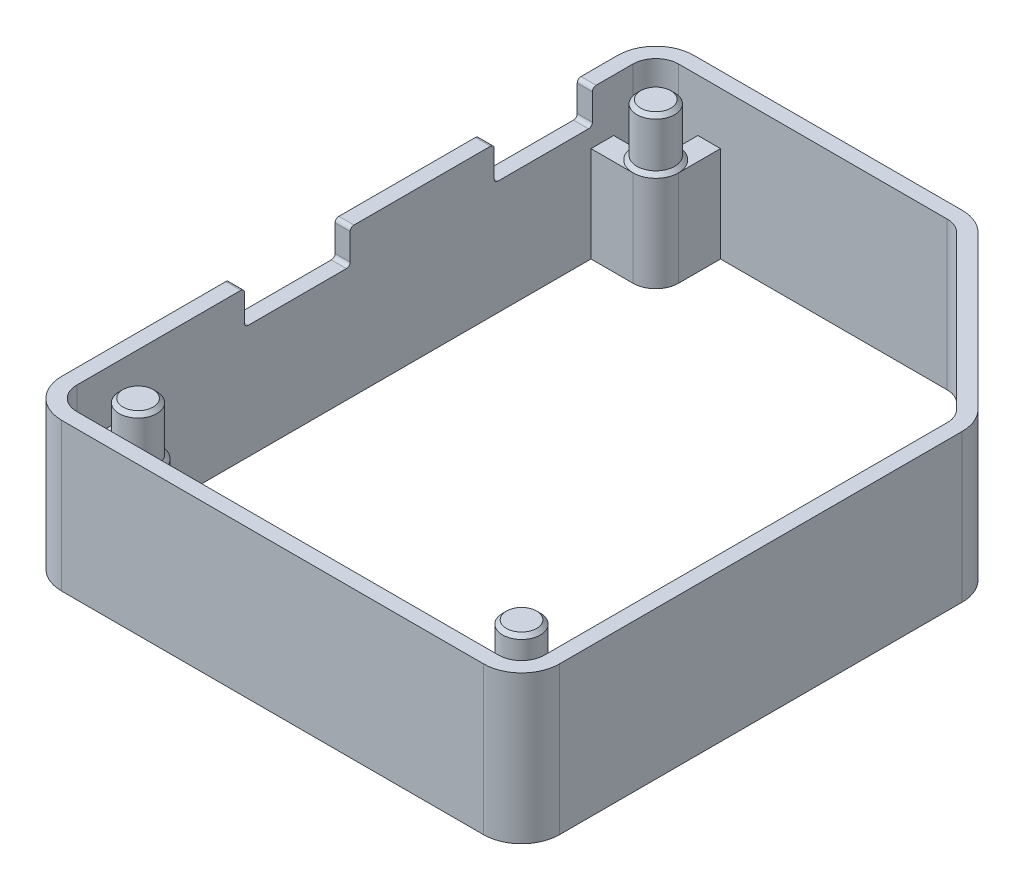
from build123d import *

# Parameters (mm, degrees)
WALLS_DEPTH               = 1.6
WALLS_DEPTH_BACK          = 18
PORTS_REACH               = 81.148
PORT_SKETCH_W             = 14
PORT_SKETCH_H             = 4.5
PORT_SKETCH_W_2           = 13
PORT_FILLET_R             = 0.5
MOUNTING_BASE_START       = -11.07
MOUNTING_BASE_SKETCH_R    = 2.5
MOUNTING_BASE_DEPTH       = 12.67
MOUNTING_PINS_START       = -18
MOUNTING_BASE_SKETCH_2_R  = 2.5
MOUNTING_PINS_DEPTH       = 19.6
MOUNTING_PIN_CHAMFER_SIZE = 0.5


with BuildPart() as part:
    # Base_Sketch → Walls (new, two sides: drawn at the far end of the back side and taken through both)
    with BuildSketch(Plane(origin=(0, -11.07, 0), x_dir=(-1, 0, 0), z_dir=(0, -1, 0)).offset(-WALLS_DEPTH_BACK)):
        with BuildLine():
            Line((-32.98, 16.51), (-32.98, -36.83))
            ThreePointArc((-32.98, -36.83), (-31.503818177, -40.393818177), (-27.94, -41.87))
            Line((-27.94, -41.87), (27.94, -41.87))
            ThreePointArc((27.94, -41.87), (31.503818177, -40.393818177), (32.98, -36.83))
            Line((32.98, -36.83), (32.98, 36.83))
            ThreePointArc((32.98, 36.83), (31.503818177, 40.393818177), (27.94, 41.87))
            Line((27.94, 41.87), (-7.62, 41.87))
            ThreePointArc((-7.62, 41.87), (-9.548724499, 41.486352844), (-11.183818177, 40.393818177))
            Line((-11.183818177, 40.393818177), (-31.503818177, 20.073818177))
            ThreePointArc((-31.503818177, 20.073818177), (-32.596352844, 18.438724499), (-32.98, 16.51))
        make_face()
        with BuildLine():
            Line((-30.98, 16.51), (-30.98, -36.83))
            ThreePointArc((-30.98, -36.83), (-30.089604615, -38.979604615), (-27.94, -39.87))
            Line((-27.94, -39.87), (27.94, -39.87))
            ThreePointArc((27.94, -39.87), (30.089604615, -38.979604615), (30.98, -36.83))
            Line((30.98, -36.83), (30.98, 36.83))
            ThreePointArc((30.98, 36.83), (30.089604615, 38.979604615), (27.94, 39.87))
            Line((27.94, 39.87), (-7.62, 39.87))
            ThreePointArc((-7.62, 39.87), (-8.783357634, 39.638593779), (-9.769604615, 38.979604615))
            Line((-9.769604615, 38.979604615), (-30.089604615, 18.659604615))
            ThreePointArc((-30.089604615, 18.659604615), (-30.748593779, 17.673357634), (-30.98, 16.51))
        make_face(mode=Mode.SUBTRACT)
    extrude(amount=WALLS_DEPTH + WALLS_DEPTH_BACK)

    # Port_Sketch → Ports (cut, up to next)
    with BuildSketch(Plane.ZY.offset(32.98), mode=Mode.PRIVATE) as ports_sk1:
        with Locations((7.61, 4.68)):
            Rectangle(PORT_SKETCH_W, PORT_SKETCH_H)
    ports_tool1 = extrude(ports_sk1.sketch, amount=-PORTS_REACH, mode=Mode.PRIVATE) & part.part
    # Port_Sketch → Ports (cut, up to next)
    with BuildSketch(Plane.ZY.offset(32.98), mode=Mode.PRIVATE) as ports_sk2:
        with Locations((-24.97, 4.68)):
            Rectangle(PORT_SKETCH_W_2, PORT_SKETCH_H)
    ports_tool2 = extrude(ports_sk2.sketch, amount=-PORTS_REACH, mode=Mode.PRIVATE) & part.part
    add(ports_tool1.solids().sort_by_distance((-32.98, 4.68, 7.61))[0], mode=Mode.SUBTRACT)
    add(ports_tool2.solids().sort_by_distance((-32.98, 4.68, -24.97))[0], mode=Mode.SUBTRACT)

    # Port_Fillet
    port_fillet_edges = [part.edges().sort_by_distance(p)[0] for p in [
        (-31.98, 6.93, -18.47),
        (-31.98, 6.93, -31.47),
        (-31.98, 2.43, -31.47),
        (-31.98, 2.43, -18.47),
        (-31.98, 2.43, 0.61),
        (-31.98, 6.93, 0.61),
        (-31.98, 6.93, 14.61),
        (-31.98, 2.43, 14.61),
    ]]
    fillet(port_fillet_edges, radius=PORT_FILLET_R)

    # Mounting_Base_Sketch → Mounting_Base (add)
    # profile 1 of 3: a face of its own
    with BuildSketch(Plane(origin=(0, -11.07, 0), x_dir=(-1, 0, 0), z_dir=(0, -1, 0)).offset(MOUNTING_BASE_START)):
        with BuildLine():
            Line((22.400144884, -34.290144884), (22.400144884, -39.87))
            Line((22.400144884, -39.87), (25.400144884, -39.87))
            Line((25.400144884, -39.87), (25.400144884, -37.290144884))
            ThreePointArc((25.400144884, -37.290144884), (27.521465228, -36.411465228), (28.400144884, -34.290144884))
            Line((28.400144884, -34.290144884), (30.98, -34.290144884))
            Line((30.98, -34.290144884), (30.98, -31.290144884))
            Line((30.98, -31.290144884), (25.400144884, -31.290144884))
            ThreePointArc((25.400144884, -31.290144884), (23.27882454, -32.16882454), (22.400144884, -34.290144884))
        make_face()
        with Locations(Location((25.400144884, -34.290144884, 0), (0, 0, 270))):
            Circle(MOUNTING_BASE_SKETCH_R, mode=Mode.SUBTRACT)
    # profile 2 of 3: a face of its own
    with BuildSketch(Plane(origin=(0, -11.07, 0), x_dir=(-1, 0, 0), z_dir=(0, -1, 0)).offset(MOUNTING_BASE_START)):
        with BuildLine():
            Line((-25.400144884, -31.290144884), (-30.98, -31.290144884))
            Line((-30.98, -31.290144884), (-30.98, -34.290144884))
            Line((-30.98, -34.290144884), (-28.400144884, -34.290144884))
            ThreePointArc((-28.400144884, -34.290144884), (-27.521465228, -36.411465228), (-25.400144884, -37.290144884))
            Line((-25.400144884, -37.290144884), (-25.400144884, -39.87))
            Line((-25.400144884, -39.87), (-22.400144884, -39.87))
            Line((-22.400144884, -39.87), (-22.400144884, -34.290144884))
            ThreePointArc((-22.400144884, -34.290144884), (-23.27882454, -32.16882454), (-25.400144884, -31.290144884))
        make_face()
        with Locations(Location((-25.400144884, -34.290144884, 0), (0, 0, 270))):
            Circle(MOUNTING_BASE_SKETCH_R, mode=Mode.SUBTRACT)
    # profile 3 of 3: a face of its own
    with BuildSketch(Plane(origin=(0, -11.07, 0), x_dir=(-1, 0, 0), z_dir=(0, -1, 0)).offset(MOUNTING_BASE_START)):
        with BuildLine():
            Line((22.400144884, 34.290144884), (22.400144884, 39.87))
            Line((22.400144884, 39.87), (25.400144884, 39.87))
            Line((25.400144884, 39.87), (25.400144884, 37.290144884))
            ThreePointArc((25.400144884, 37.290144884), (27.521465228, 36.411465228), (28.400144884, 34.290144884))
            Line((28.400144884, 34.290144884), (30.98, 34.290144884))
            Line((30.98, 34.290144884), (30.98, 31.290144884))
            Line((30.98, 31.290144884), (25.400144884, 31.290144884))
            ThreePointArc((25.400144884, 31.290144884), (23.27882454, 32.16882454), (22.400144884, 34.290144884))
        make_face()
        with Locations(Location((25.400144884, 34.290144884, 0), (0, 0, 270))):
            Circle(MOUNTING_BASE_SKETCH_R, mode=Mode.SUBTRACT)
    extrude(amount=MOUNTING_BASE_DEPTH)

    # Mounting_Base_Sketch<2> → Mounting_Pins (add)
    with BuildSketch(Plane(origin=(0, -11.07, 0), x_dir=(-1, 0, 0), z_dir=(0, -1, 0)).offset(MOUNTING_PINS_START)):
        with Locations(Location((-25.400144884, -34.290144884, 0), (0, 0, 90))):
            Circle(MOUNTING_BASE_SKETCH_2_R)
        with Locations(Location((25.400144884, -34.290144884, 0), (0, 0, 90))):
            Circle(MOUNTING_BASE_SKETCH_2_R)
        with Locations(Location((25.400144884, 34.290144884, 0), (0, 0, 90))):
            Circle(MOUNTING_BASE_SKETCH_2_R)
    extrude(amount=MOUNTING_PINS_DEPTH)

    # Mounting_Pin_Chamfer
    mounting_pin_chamfer_edges = [part.edges().sort_by_distance(p)[0] for p in [
        (25.400144884, 0, 36.790144884),
        (-25.400144884, 0, 36.790144884),
        (-25.400144884, 0, -31.790144884),
        (25.400144884, 6.93, 36.790144884),
        (-25.400144884, 6.93, 36.790144884),
        (-25.400144884, 6.93, -31.790144884),
    ]]
    chamfer(mounting_pin_chamfer_edges, length=MOUNTING_PIN_CHAMFER_SIZE - 0.0001)  # a hair under: the kernel refuses the full size


solid = part.part
